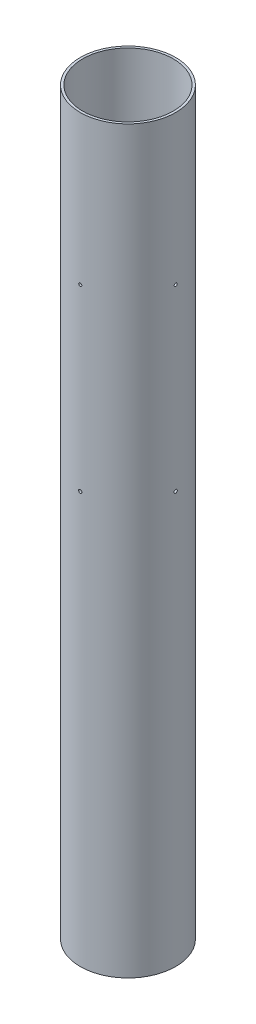
from build123d import *

# Parameters (mm, degrees)
SKETCH1_R                 = 50.8
SKETCH1_R_2               = 48.26
COUPLER_EXTRUSION_DEPTH   = 787.4
BULKHEAD_HOLE_REACH       = 797.551
SKETCH2_R                 = 1.6383
CIRPATTERN1_COUNT         = 4
LOWER_BULKHEAD_HOLE_REACH = 797.551
SKETCH3_R                 = 1.7526
CIRPATTERN2_COUNT         = 4


with BuildPart() as part:
    # Sketch1 → Coupler Extrusion (new body)
    with BuildSketch(Plane(origin=(0, 0, 0), x_dir=(1, 0, 0), z_dir=(0, 1, 0))):
        Circle(SKETCH1_R)
        Circle(SKETCH1_R_2, mode=Mode.SUBTRACT)
    extrude(amount=COUPLER_EXTRUSION_DEPTH)

    # Sketch2 → Bulkhead Hole (cut, up to next)
    with BuildSketch(Plane.XY.offset(50.8), mode=Mode.PRIVATE) as bulkhead_hole_sk1:
        with Locations((0, 628.65)):
            Circle(SKETCH2_R)
    bulkhead_hole_tool1 = extrude(bulkhead_hole_sk1.sketch, amount=-BULKHEAD_HOLE_REACH, mode=Mode.PRIVATE) & part.part
    bulkhead_hole = bulkhead_hole_tool1.solids().sort_by_distance((0, 628.65, 50.8))[0]
    add(bulkhead_hole, mode=Mode.SUBTRACT)

    # CirPattern1: Bulkhead Hole ×4 about axis
    cirpattern1_axis = Axis((0, 787.4, 0), (0, -1, 0))
    for i in range(1, CIRPATTERN1_COUNT):
        add(bulkhead_hole.rotate(cirpattern1_axis, i * 360 / CIRPATTERN1_COUNT), mode=Mode.SUBTRACT)

    # Sketch3 → Lower Bulkhead Hole (cut, up to next)
    with BuildSketch(Plane.XY.offset(50.8), mode=Mode.PRIVATE) as lower_bulkhead_hole_sk1:
        with Locations((0, 438.15)):
            Circle(SKETCH3_R)
    lower_bulkhead_hole_tool1 = extrude(lower_bulkhead_hole_sk1.sketch, amount=-LOWER_BULKHEAD_HOLE_REACH, mode=Mode.PRIVATE) & part.part
    lower_bulkhead_hole = lower_bulkhead_hole_tool1.solids().sort_by_distance((0, 438.15, 50.8))[0]
    add(lower_bulkhead_hole, mode=Mode.SUBTRACT)

    # CirPattern2: Lower Bulkhead Hole ×4 about axis
    cirpattern2_axis = Axis((0, 787.4, 0), (0, -1, 0))
    for i in range(1, CIRPATTERN2_COUNT):
        add(lower_bulkhead_hole.rotate(cirpattern2_axis, i * 360 / CIRPATTERN2_COUNT), mode=Mode.SUBTRACT)


solid = part.part
